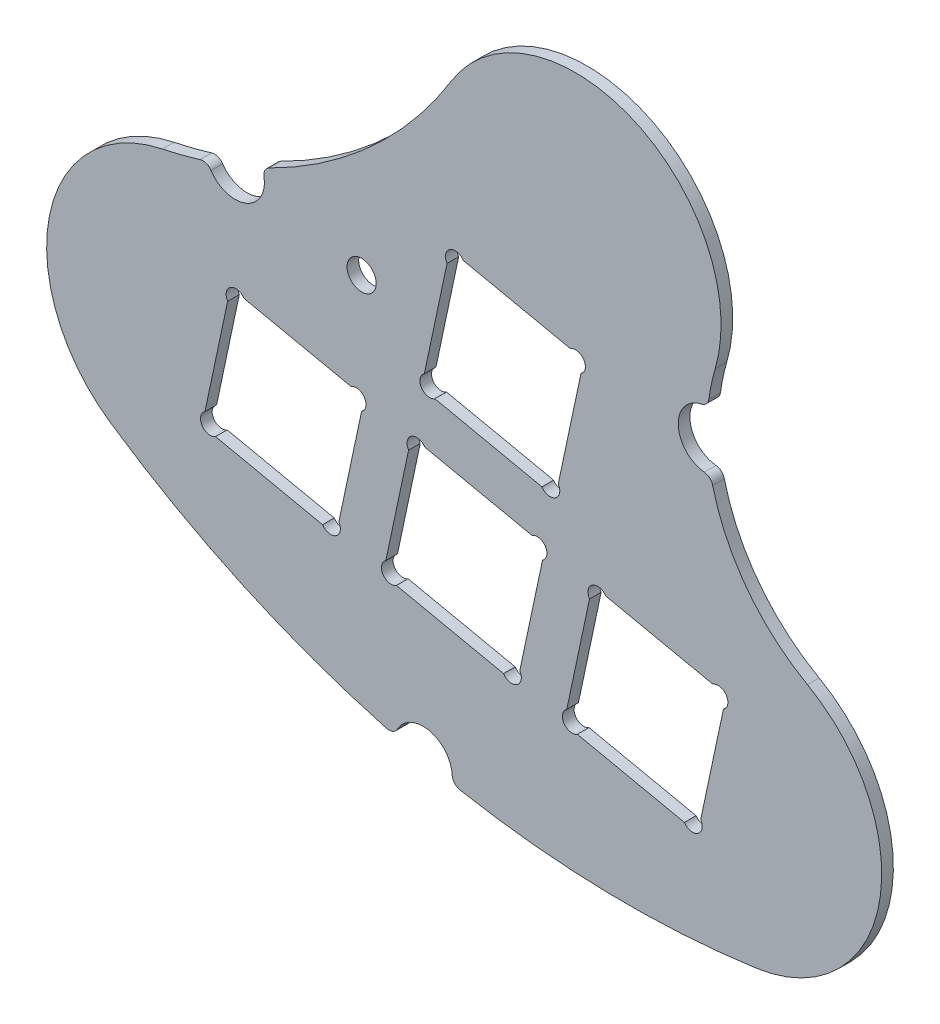
from build123d import *
from build123d.topology import SkipClean

# Parameters (mm, degrees)
BOSS_EXTRUDE1_DEPTH   = 1.2
SKETCH8_3_R           = 3
CUT_EXTRUDE1_DEPTH    = 182.287051241
CUT_EXTRUDE2_DEPTH    = 182.287051241
SKETCH10_W            = 14.1
SKETCH10_H            = 14.1
CUT_EXTRUDE3_DEPTH    = 185.638971815
F_3_0MM_DOWEL_HOLE1_D = 3
FILLET1_R             = 1


with BuildPart() as part:
    # Sketch8 → Boss-Extrude1 (new body)
    with BuildSketch(Plane.XY):
        with BuildLine():
            ThreePointArc((73.852303576, 63.794594289), (73.863549821, 63.839319131), (73.875482243, 63.883865813))
            ThreePointArc((73.875482243, 63.883865813), (76.767270103, 63.085390407), (79.729789892, 62.612657392))
            ThreePointArc((79.729789892, 62.612657392), (79.717062502, 62.538833177), (79.702495752, 62.465349771))
            ThreePointArc((79.702495752, 62.465349771), (95.373691885, 60.7573177), (111.111302129, 61.669121188))
            ThreePointArc((111.111302129, 61.669121188), (123.74416397, 73.75113123), (116.356165737, 89.593531525))
            ThreePointArc((116.356165737, 89.593531525), (107.510169126, 99.635128091), (106.844308874, 113.000828513))
            ThreePointArc((106.844308874, 113.000828513), (98.551785503, 130.943955248), (79.67265081, 125.087333856))
            ThreePointArc((79.67265081, 125.087333856), (66.957923375, 111.551078569), (49.923987164, 104.152462611))
            ThreePointArc((49.923987164, 104.152462611), (38.279791522, 92.371702096), (44.581782069, 77.053134095))
            ThreePointArc((44.581782069, 77.053134095), (58.651333394, 69.17496271), (73.852303576, 63.794594289))
        make_face()
        with BuildLine():
            ThreePointArc((56.72077423, 104.000844147), (56.721683918, 104.00117089), (56.7225936, 104.001497652))
            ThreePointArc((56.7225936, 104.001497652), (56.755397532, 103.992206145), (56.788325126, 103.983362865))
            ThreePointArc((56.788325126, 103.983362865), (56.754559843, 103.992142785), (56.72077423, 104.000844147))
        make_face(mode=Mode.SUBTRACT)
        with BuildLine():
            ThreePointArc((109.376341775, 92.015545509), (109.37615287, 92.017539878), (109.375963817, 92.019534234))
            ThreePointArc((109.375963817, 92.019534234), (109.377797318, 92.017499849), (109.379631064, 92.015465685))
            ThreePointArc((109.379631064, 92.015465685), (109.377986421, 92.015505684), (109.376341775, 92.015545509))
        make_face(mode=Mode.SUBTRACT)
        with BuildLine():
            ThreePointArc((103.532400156, 106.396636288), (103.543227812, 106.407709628), (103.554044399, 106.418793781))
            ThreePointArc((103.554044399, 106.418793781), (103.552293137, 106.396310438), (103.550744757, 106.373812212))
            ThreePointArc((103.550744757, 106.373812212), (103.541575551, 106.385226737), (103.532400156, 106.396636288))
        make_face(mode=Mode.SUBTRACT)
        with BuildLine():
            ThreePointArc((104.021801646, 107.681154775), (104.021865069, 107.684582448), (104.021929019, 107.688010111))
            ThreePointArc((104.021929019, 107.688010111), (104.063142491, 107.7381429), (104.104138674, 107.788453533))
            ThreePointArc((104.104138674, 107.788453533), (104.062244422, 107.735361058), (104.021801646, 107.681154775))
        make_face(mode=Mode.SUBTRACT)
    extrude(amount=BOSS_EXTRUDE1_DEPTH)

    # Sketch8<3> → Cut-Extrude1 (cut, through all)
    with SkipClean():  # the faces are left unmerged after this step: merging them gives an invalid solid
        with BuildSketch(Plane.XY):
            with Locations((106.04559389, 106.21341333)):
                Circle(SKETCH8_3_R)
            with Locations((76.767270103, 63.085390407)):
                Circle(SKETCH8_3_R)
            with Locations((57.420286528, 106.402169345)):
                Circle(SKETCH8_3_R)
        extrude(amount=CUT_EXTRUDE1_DEPTH, mode=Mode.SUBTRACT)

    # Sketch14 → Cut-Extrude2 (cut, through all)
    with SkipClean():  # the faces are left unmerged after this step: merging them gives an invalid solid
        with BuildSketch(Plane.XY):
            with BuildLine():
                Line((54.297852906, 82.909160119), (55.387130976, 81.231818983))
                ThreePointArc((55.387130976, 81.231818983), (54.003821373, 81.525850516), (54.297852906, 82.909160119))
            make_face()
            with BuildLine():
                Line((56.641344681, 93.934422083), (58.318685817, 95.023700153))
                ThreePointArc((58.318685817, 95.023700153), (56.935376214, 95.317731686), (56.641344681, 93.934422083))
            make_face()
            with BuildLine():
                Line((69.343947781, 92.680208378), (70.433225851, 91.002867242))
                ThreePointArc((70.433225851, 91.002867242), (70.727257384, 92.386176845), (69.343947781, 92.680208378))
            make_face()
            with BuildLine():
                Line((68.089734077, 79.977605278), (66.412392941, 78.888327208))
                ThreePointArc((66.412392941, 78.888327208), (67.795702544, 78.594295675), (68.089734077, 79.977605278))
            make_face()
            with BuildLine():
                Line((75.275056475, 89.973704373), (76.952397611, 91.062982443))
                ThreePointArc((76.952397611, 91.062982443), (75.569088008, 91.357013976), (75.275056475, 89.973704373))
            make_face()
            with BuildLine():
                Line((72.9315647, 78.948442409), (74.02084277, 77.271101273))
                ThreePointArc((74.02084277, 77.271101273), (72.637533167, 77.565132806), (72.9315647, 78.948442409))
            make_face()
            with BuildLine():
                Line((85.046104735, 74.927609498), (86.723445871, 76.016887568))
                ThreePointArc((86.723445871, 76.016887568), (86.429414338, 74.633577965), (85.046104735, 74.927609498))
            make_face()
            with BuildLine():
                Line((89.066937645, 87.042149532), (87.977659575, 88.719490668))
                ThreePointArc((87.977659575, 88.719490668), (89.360969178, 88.425459135), (89.066937645, 87.042149532))
            make_face()
            with BuildLine():
                Line((89.006822445, 93.561321292), (90.684163581, 94.650599362))
                ThreePointArc((90.684163581, 94.650599362), (90.390132048, 93.267289759), (89.006822445, 93.561321292))
            make_face()
            with BuildLine():
                Line((76.89228241, 97.582154203), (77.981560481, 95.904813067))
                ThreePointArc((77.981560481, 95.904813067), (76.598250878, 96.1988446), (76.89228241, 97.582154203))
            make_face()
            with BuildLine():
                Line((91.938377285, 107.353202462), (93.027655356, 105.675861326))
                ThreePointArc((93.027655356, 105.675861326), (93.321686888, 107.059170929), (91.938377285, 107.353202462))
            make_face()
            with BuildLine():
                Line((79.235774185, 108.607416167), (80.913115321, 109.696694237))
                ThreePointArc((80.913115321, 109.696694237), (79.529805718, 109.99072577), (79.235774185, 108.607416167))
            make_face()
            with BuildLine():
                Line((93.908768269, 86.012986663), (95.586109405, 87.102264733))
                ThreePointArc((95.586109405, 87.102264733), (94.202799802, 87.396296266), (93.908768269, 86.012986663))
            make_face()
            with BuildLine():
                Line((91.565276494, 74.987724698), (92.654554564, 73.310383563))
                ThreePointArc((92.654554564, 73.310383563), (91.271244961, 73.604415095), (91.565276494, 74.987724698))
            make_face()
            with BuildLine():
                Line((103.679816529, 70.966891788), (105.357157665, 72.056169858))
                ThreePointArc((105.357157665, 72.056169858), (105.063126132, 70.672860255), (103.679816529, 70.966891788))
            make_face()
            with BuildLine():
                Line((106.611371369, 84.758772958), (107.700649439, 83.081431822))
                ThreePointArc((107.700649439, 83.081431822), (107.994680972, 84.464741425), (106.611371369, 84.758772958))
            make_face()
        extrude(amount=CUT_EXTRUDE2_DEPTH, mode=Mode.SUBTRACT)

    # Sketch10 → Cut-Extrude3 (cut, through all)
    with SkipClean():  # the faces are left unmerged after this step: merging them gives an invalid solid
        with BuildSketch(Plane(origin=(-22.098060608, 19.345391025, 0), x_dir=(0.9781476007338056, -0.2079116908177598, 0), z_dir=(0, 0, 1))):
            with Locations((68.560828803, 83.69413822)):
                Rectangle(SKETCH10_W, SKETCH10_H)
            with Locations((87.610828803, 83.69413822)):
                Rectangle(SKETCH10_W, SKETCH10_H)
            with Locations((106.660828803, 83.69413822)):
                Rectangle(SKETCH10_W, SKETCH10_H)
            with Locations((87.610828803, 102.74413822)):
                Rectangle(SKETCH10_W, SKETCH10_H)
        extrude(amount=CUT_EXTRUDE3_DEPTH, mode=Mode.SUBTRACT)

    # Ø3.0mm Dowel Hole1 (through all)
    with Locations(Plane.XY.offset(1.2)):
        with Locations((70.435309654, 103.157249982)):
            Hole(F_3_0MM_DOWEL_HOLE1_D / 2)

    # Fillet1
    fillet1_edges = [part.edges().sort_by_distance(p)[0] for p in [
        (79.702495752, 62.465349771, 0.6),
        (73.852303576, 63.794594289, 0.6),
        (106.42311517, 103.237261841, 0.6),
        (106.111211206, 109.212695638, 0.6),
        (54.596217873, 105.389926178, 0.6),
        (60.17229201, 107.596516793, 0.6),
    ]]
    fillet(fillet1_edges, radius=FILLET1_R)


solid = part.part
